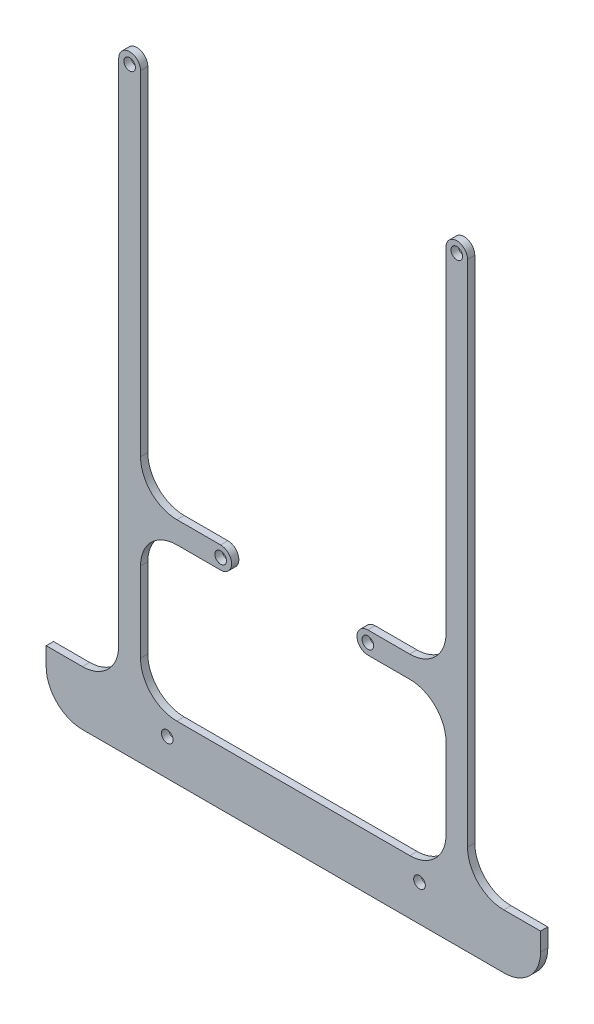
from build123d import *

# Parameters (mm, degrees)
SKETCH1_R           = 1.6
BOSS_EXTRUDE1_DEPTH = 2


with BuildPart() as part:
    # Sketch1 → Boss-Extrude1 (new body)
    with BuildSketch(Plane.XY):
        with BuildLine():
            ThreePointArc((-42.044206104, 75), (-45.044206104, 78), (-48.044206104, 75))
            Line((-48.044206104, 75), (-48.044206104, -65))
            ThreePointArc((-48.044206104, -65), (-50.973138292, -72.071067812), (-58.044206104, -75))
            Line((-58.044206104, -75), (-68, -75))
            Line((-68, -75), (-68, -80))
            ThreePointArc((-68, -80), (-65.071067812, -87.071067812), (-58, -90))
            Line((-58, -90), (58, -90))
            ThreePointArc((58, -90), (65.071067812, -87.071067812), (68, -80))
            Line((68, -80), (68, -75))
            Line((68, -75), (57.867381689, -75))
            ThreePointArc((57.867381689, -75), (50.827572313, -72.08401548), (47.911587793, -65.044206104))
            Line((47.911587793, -65.044206104), (47.911587793, 75))
            ThreePointArc((47.911587793, 75), (44.955793896, 77.955793896), (42, 75))
            Line((42, 75), (42, -17))
            ThreePointArc((42, -17), (39.071067812, -24.071067812), (32, -27))
            Line((32, -27), (20.5, -27))
            ThreePointArc((20.5, -27), (17.5, -30), (20.5, -33))
            Line((20.5, -33), (32.044206104, -33))
            ThreePointArc((32.044206104, -33), (39.08401548, -35.91598452), (42, -42.955793896))
            Line((42, -42.955793896), (42, -65.044206104))
            ThreePointArc((42, -65.044206104), (39.08401548, -72.08401548), (32.044206104, -75))
            Line((32.044206104, -75), (-32.044206104, -75))
            ThreePointArc((-32.044206104, -75), (-39.115273915, -72.071067812), (-42.044206104, -65))
            Line((-42.044206104, -65), (-42.044206104, -43))
            ThreePointArc((-42.044206104, -43), (-39.115273915, -35.928932188), (-32.044206104, -33))
            Line((-32.044206104, -33), (-20, -33))
            ThreePointArc((-20, -33), (-17, -30), (-20, -27))
            Line((-20, -27), (-32.044206104, -27))
            ThreePointArc((-32.044206104, -27), (-39.115273915, -24.071067812), (-42.044206104, -17))
            Line((-42.044206104, -17), (-42.044206104, 75))
        make_face()
        with Locations((-34.7, -80)):
            Circle(SKETCH1_R, mode=Mode.SUBTRACT)
        with Locations((-20, -30)):
            Circle(SKETCH1_R, mode=Mode.SUBTRACT)
        with BuildLine():
            ThreePointArc((36.3, -80), (34.7, -81.6), (33.1, -80))
            ThreePointArc((33.1, -80), (34.7, -78.4), (36.3, -80))
        make_face(mode=Mode.SUBTRACT)
        with Locations((20.5, -30)):
            Circle(SKETCH1_R, mode=Mode.SUBTRACT)
        with Locations((-45.044206104, 75)):
            Circle(SKETCH1_R, mode=Mode.SUBTRACT)
        with Locations((44.955793896, 75)):
            Circle(SKETCH1_R, mode=Mode.SUBTRACT)
    extrude(amount=BOSS_EXTRUDE1_DEPTH)


solid = part.part
